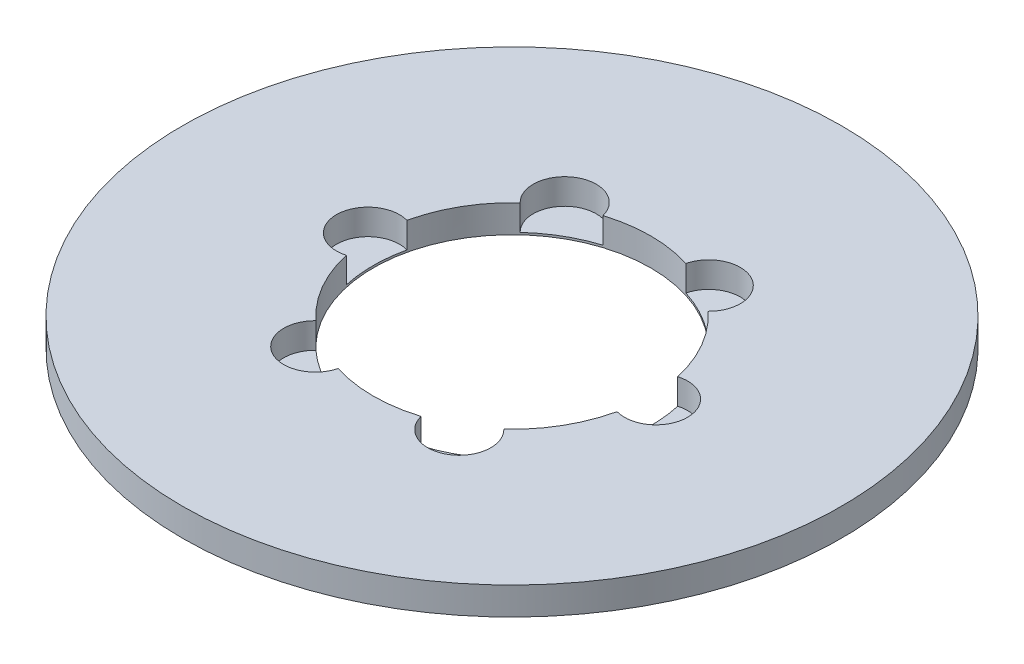
from build123d import *

# Parameters (mm, degrees)
SKETCH1_R           = 95
BOSS_EXTRUDE1_DEPTH = 8
SKETCH2_R           = 40
CUT_EXTRUDE1_DEPTH  = 135.588261004
SKETCH3_R           = 9.08729981
CUT_EXTRUDE2_DEPTH  = 7.388473131
CIRPATTERN1_COUNT   = 6


with BuildPart() as part:
    # Sketch1 → Boss-Extrude1 (new body)
    with BuildSketch(Plane(origin=(0, 0, 0), x_dir=(1, 0, 0), z_dir=(0, 1, 0))):
        Circle(SKETCH1_R)
    extrude(amount=BOSS_EXTRUDE1_DEPTH)

    # Sketch2 → Cut-Extrude1 (cut, through all)
    with BuildSketch(Plane(origin=(0, 0, 0), x_dir=(1, 0, 0), z_dir=(0, 1, 0))):
        Circle(SKETCH2_R)
    extrude(amount=CUT_EXTRUDE1_DEPTH, mode=Mode.SUBTRACT)

    # Sketch3 → Cut-Extrude2 (cut)
    with BuildSketch(Plane(origin=(0, 8, 0), x_dir=(1, 0, 0), z_dir=(0, 1, 0))):
        with Locations((-41.518891417, 0)):
            Circle(SKETCH3_R)
    cut_extrude2 = extrude(amount=-CUT_EXTRUDE2_DEPTH, mode=Mode.SUBTRACT)

    # CirPattern1: Cut-Extrude2 ×6 about axis
    cirpattern1_axis = Axis((0, 0, 0), (0, 1, 0))
    for i in range(1, CIRPATTERN1_COUNT):
        add(cut_extrude2.rotate(cirpattern1_axis, i * 360 / CIRPATTERN1_COUNT), mode=Mode.SUBTRACT)


solid = part.part
